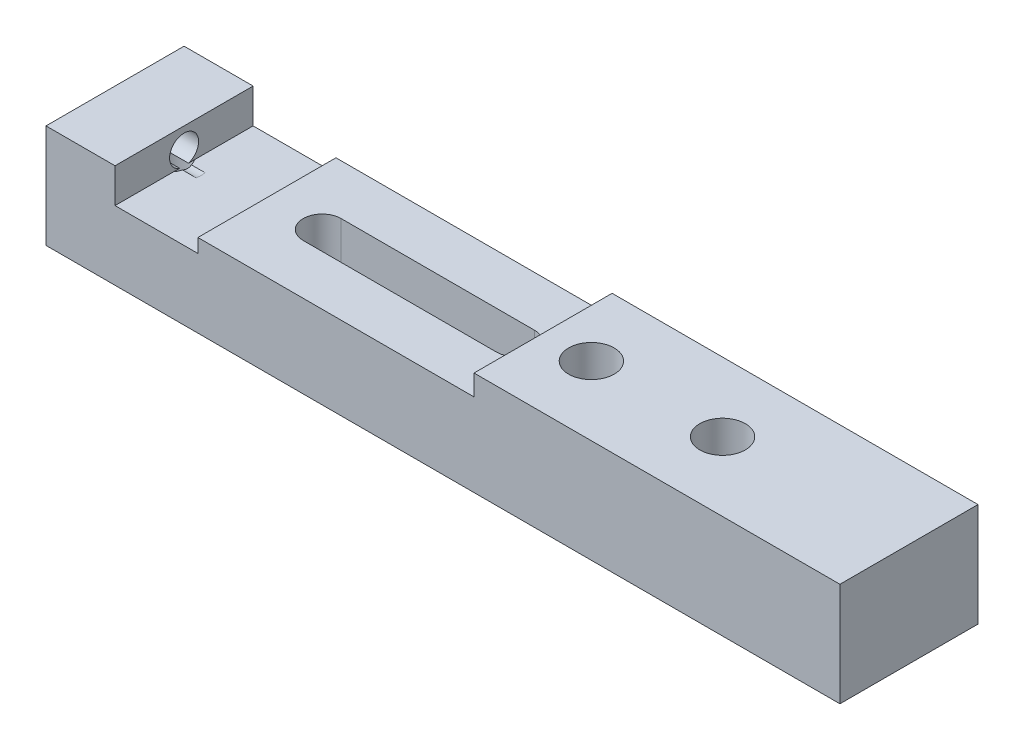
from build123d import *

# Parameters (mm, degrees)
SKETCH_1_W                 = 115
SKETCH_1_H                 = 15
EXTRUDE_1_DEPTH            = 20
SKETCH_2_W                 = 12
SKETCH_2_H                 = 20
CUT_EXTRUDE_1_DEPTH        = 5
SKETCH_3_W                 = 40
SKETCH_3_H                 = 20
CUT_EXTRUDE_2_DEPTH        = 3
HOLE_START                 = -7.5
HOLE_WIZARD_M6_1_OUTLINE_R = 2.5
HOLE_WIZARD_M6_1_DEPTH     = 10
CUT_EXTRUDE_3_DEPTH        = 5
CUT_EXTRUDE_4_DEPTH        = 20
HOLE_WIZARD_3_D            = 6.6
HOLE_WIZARD_3_DEPTH        = 15
HOLE_WIZARD_3_CBORE_D      = 11
HOLE_WIZARD_3_CBORE_DEPTH  = 4.7
HOLE_WIZARD_3_TIP          = 1.982840043
HOLE_WIZARD_M5_1_D         = 4.2
HOLE_WIZARD_M5_1_DEPTH     = 12.4
HOLE_WIZARD_M5_1_TIP       = 1.2618073


# Read off the part's stored shape, not the designer's step: M6 螺纹孔1
with BuildPart() as part:
    # 草图1 → 凸台-拉伸1 (new body)
    with BuildSketch(Plane.XY):
        Rectangle(SKETCH_1_W, SKETCH_1_H)
    extrude(amount=EXTRUDE_1_DEPTH)

    # 草图2 → 切除-拉伸1 (cut)
    with BuildSketch(Plane(origin=(0, 7.5, 0), x_dir=(1, 0, 0), z_dir=(0, 1, 0))):
        with Locations((-41.5, -10)):
            Rectangle(SKETCH_2_W, SKETCH_2_H)
    extrude(amount=-CUT_EXTRUDE_1_DEPTH, mode=Mode.SUBTRACT)

    # 草图3 → 切除-拉伸2 (cut)
    with BuildSketch(Plane(origin=(0, 7.5, 0), x_dir=(1, 0, 0), z_dir=(0, 1, 0))):
        with Locations((-15.5, -10)):
            Rectangle(SKETCH_3_W, SKETCH_3_H)
    extrude(amount=-CUT_EXTRUDE_2_DEPTH, mode=Mode.SUBTRACT)

    # M6 螺纹孔1 outline → M6 螺纹孔1 (cut)
    with BuildSketch(Plane(origin=(0, 0, 0), x_dir=(1, 0, 0), z_dir=(0, 1, 0)).offset(HOLE_START)):
        with Locations((-49.5, -10)):
            Circle(HOLE_WIZARD_M6_1_OUTLINE_R)
    extrude(amount=HOLE_WIZARD_M6_1_DEPTH, mode=Mode.SUBTRACT)

    # Hole Wizard M6 _1 2 outline → Hole Wizard M6 _1 2 (revolve, cut)
    with BuildSketch(Plane(origin=(20.5, 0, 10), x_dir=(1, 0, 0), z_dir=(0, 0, 1))):
        Polygon((2.5, 2.5), (0, 4.002151548), (0, -7.5), (2.5, -7.5), align=None)
    revolve(axis=Axis((20.5, 0, 10), (0, 1, 0)), mode=Mode.SUBTRACT)

    # 草图6 → 切除-拉伸3 (cut)
    with BuildSketch(Plane.XZ.offset(7.5)):
        with BuildLine():
            Line((-27.5, 15), (0.5, 15))
            ThreePointArc((0.5, 15), (5.5, 10), (0.5, 5))
            Line((0.5, 5), (-27.5, 5))
            ThreePointArc((-27.5, 5), (-32.5, 10), (-27.5, 15))
        make_face()
    extrude(amount=-CUT_EXTRUDE_3_DEPTH, mode=Mode.SUBTRACT)

    # 草图7 → 切除-拉伸4 (cut)
    with BuildSketch(Plane.XZ.offset(2.5)):
        with BuildLine():
            Line((-27.5, 7.25), (0.5, 7.25))
            ThreePointArc((0.5, 7.25), (3.25, 10), (0.5, 12.75))
            Line((0.5, 12.75), (-27.5, 12.75))
            ThreePointArc((-27.5, 12.75), (-30.25, 10), (-27.5, 7.25))
        make_face()
    extrude(amount=-CUT_EXTRUDE_4_DEPTH, mode=Mode.SUBTRACT)

    # 打孔尺寸(%根据)内六角花形圆柱头螺钉3
    with Locations(Plane(origin=(11.5, -7.5, 10), x_dir=(0, 0, -1), z_dir=(0, -1, 0))):
        with Locations((0, 0), (0, 19)):
            CounterBoreHole(HOLE_WIZARD_3_D / 2, HOLE_WIZARD_3_CBORE_D / 2, HOLE_WIZARD_3_CBORE_DEPTH, depth=HOLE_WIZARD_3_DEPTH)
            with Locations((0, 0, -(HOLE_WIZARD_3_DEPTH + HOLE_WIZARD_3_TIP / 2))):  # 118° drill point
                Cone(0, HOLE_WIZARD_3_D / 2, HOLE_WIZARD_3_TIP, mode=Mode.SUBTRACT)

    # M5 螺纹孔1
    with Locations(Plane(origin=(-57.5, 4.5, 10), x_dir=(0, 0, -1), z_dir=(-1, 0, 0))):
        with Locations((0, 0)):
            Hole(HOLE_WIZARD_M5_1_D / 2, depth=HOLE_WIZARD_M5_1_DEPTH)
            with Locations((0, 0, -(HOLE_WIZARD_M5_1_DEPTH + HOLE_WIZARD_M5_1_TIP / 2))):  # 118° drill point
                Cone(0, HOLE_WIZARD_M5_1_D / 2, HOLE_WIZARD_M5_1_TIP, mode=Mode.SUBTRACT)


solid = part.part
